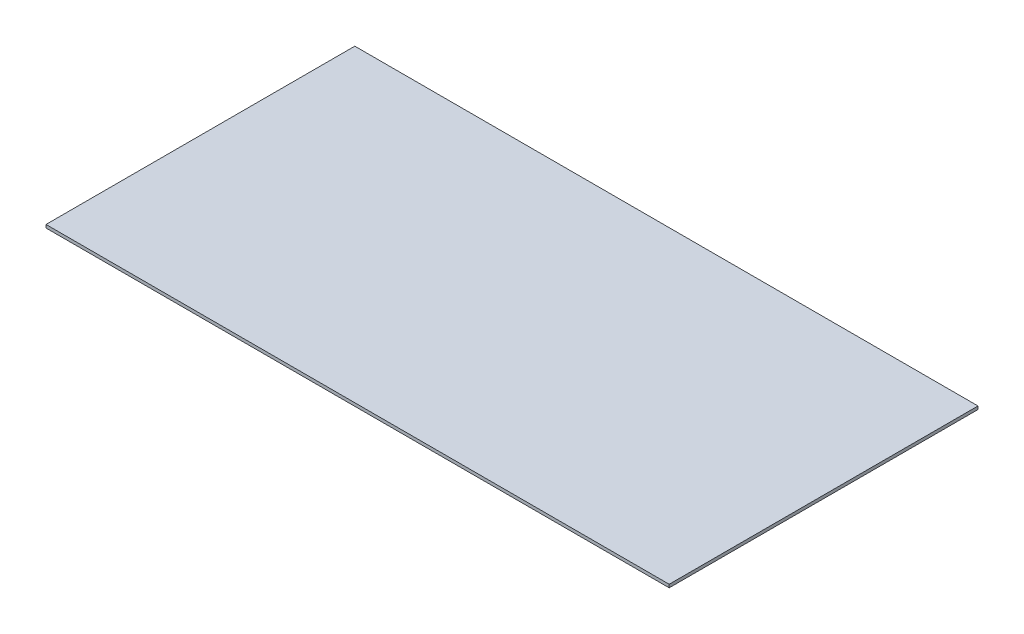
from build123d import *

# Parameters (mm, degrees)
SKETCH1_W           = 457.2
SKETCH1_H           = 2.286
BOSS_EXTRUDE1_DEPTH = 223.380000026
SKETCH2_W           = 457.2
SKETCH2_H           = 2.286
BOSS_EXTRUDE2_DEPTH = 3.175


with BuildPart() as part:
    # Sketch1 → Boss-Extrude1 (new body)
    with BuildSketch(Plane.XY):
        Rectangle(SKETCH1_W, SKETCH1_H)
    extrude(amount=BOSS_EXTRUDE1_DEPTH)

    # Sketch2 → Boss-Extrude2 (add)
    with BuildSketch(Plane(origin=(0, 0, 0), x_dir=(-1, 0, 0), z_dir=(0, 0, -1))):
        Rectangle(SKETCH2_W, SKETCH2_H)
    extrude(amount=BOSS_EXTRUDE2_DEPTH)


solid = part.part
